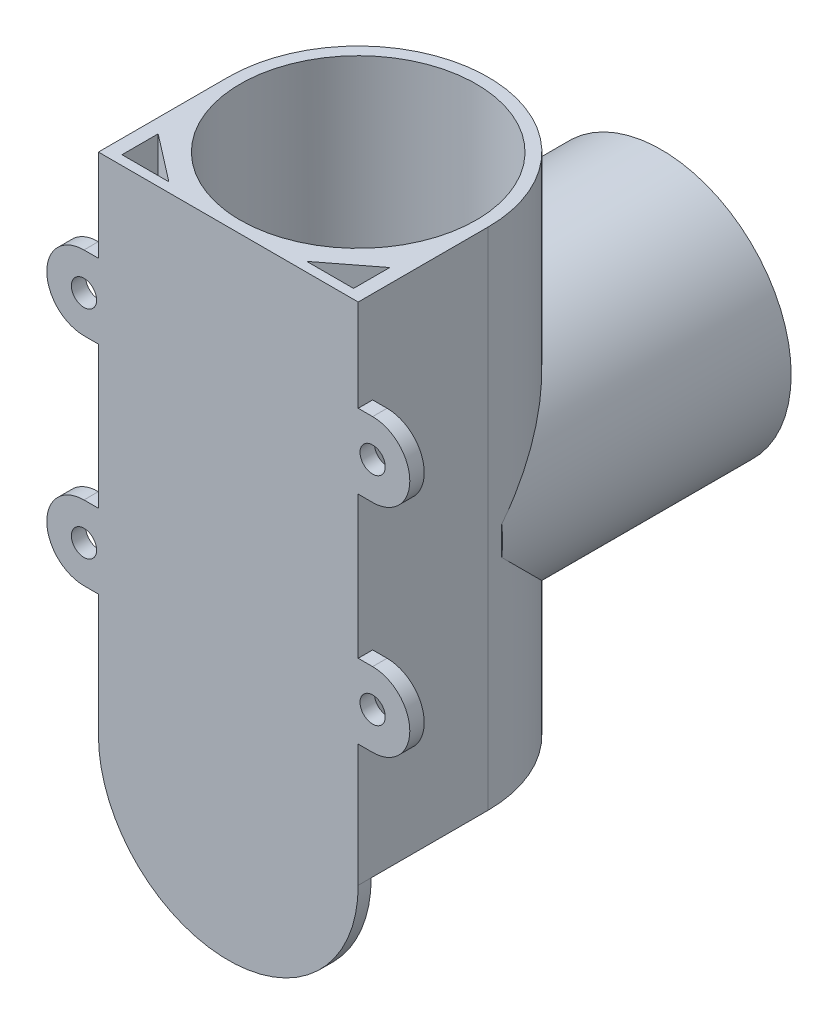
from build123d import *

# Parameters (mm, degrees)
SKETCH1_R               = 16.35
BOSS_EXTRUDE1_DEPTH     = 70
BOSS_EXTRUDE3_DEPTH     = 1.8
SKETCH6_R               = 1.75
BOSS_EXTRUDE4_DEPTH     = 2
CUT_EXTRUDE4_START      = -10
SKETCH2_R               = 15.24
CUT_EXTRUDE4_DEPTH      = 90
EXTRUDE_THIN1_START     = -2
SKETCH8_R               = 18
SKETCH8_R_2             = 16
EXTRUDE_THIN1_DEPTH     = 40
CUT_EXTRUDE5_DEPTH      = 86.419835842
CUT_EXTRUDE5_DEPTH_BACK = 86.419835842
SKETCH9_R               = 16.35


with BuildPart() as part:
    # Sketch1 → Boss-Extrude1 (new body)
    with BuildSketch(Plane(origin=(0, 0, 0), x_dir=(1, 0, 0), z_dir=(0, 1, 0))):
        with BuildLine():
            Line((18, -18), (-18, -18))
            Line((-18, -18), (-18, 0))
            ThreePointArc((-18, 0), (0, 18), (18, 0))
            Line((18, 0), (18, -18))
        make_face()
        Circle(SKETCH1_R, mode=Mode.SUBTRACT)
        Polygon((-16.046179107, -16.69097289), (-9.54916716, -16.69097289), (-16.046179107, -11.676500582), align=None, mode=Mode.SUBTRACT)
        Polygon((16.046179107, -16.69097289), (9.54916716, -16.69097289), (16.046179107, -11.676500582), align=None, mode=Mode.SUBTRACT)
    extrude(amount=BOSS_EXTRUDE1_DEPTH)

    # Sketch4 → Boss-Extrude3 (add)
    with BuildSketch(Plane.XY.offset(18)):
        with BuildLine():
            Line((-18, 0), (18, 0))
            ThreePointArc((18, 0), (0, -18), (-18, 0))
        make_face()
    extrude(amount=-BOSS_EXTRUDE3_DEPTH)

    # Sketch6 → Boss-Extrude4 (add)
    # profile 1 of 4: a face of its own
    with BuildSketch(Plane.XY.offset(18)):
        with BuildLine():
            Line((-12.295931899, 27.247291992), (-12.295931899, 16.947291992))
            Line((-12.295931899, 16.947291992), (-20, 16.947291992))
            ThreePointArc((-20, 16.947291992), (-25.15, 22.097291992), (-20, 27.247291992))
            Line((-20, 27.247291992), (-12.295931899, 27.247291992))
        make_face()
        with Locations((-20, 22.097291992)):
            Circle(SKETCH6_R, mode=Mode.SUBTRACT)
    # profile 2 of 4: a face of its own
    with BuildSketch(Plane.XY.offset(18)):
        with BuildLine():
            Line((-20, 46.94677842), (-12.295931899, 46.94677842))
            Line((-12.295931899, 46.94677842), (-12.295931899, 57.247805565))
            Line((-12.295931899, 57.247805565), (-20, 57.247805565))
            ThreePointArc((-20, 57.247805565), (-25.150513572, 52.097291992), (-20, 46.94677842))
        make_face()
        with Locations((-20, 52.097291992)):
            Circle(SKETCH6_R, mode=Mode.SUBTRACT)
    # profile 3 of 4: a face of its own
    with BuildSketch(Plane.XY.offset(18)):
        with BuildLine():
            Line((9.171216253, 57.247805565), (20, 57.247805565))
            ThreePointArc((20, 57.247805565), (25.150513572, 52.097291992), (20, 46.94677842))
            Line((20, 46.94677842), (9.171216253, 46.94677842))
            Line((9.171216253, 46.94677842), (9.171216253, 57.247805565))
        make_face()
        with Locations((20, 52.097291992)):
            Circle(SKETCH6_R, mode=Mode.SUBTRACT)
    # profile 4 of 4: a face of its own
    with BuildSketch(Plane.XY.offset(18)):
        with BuildLine():
            Line((9.171216253, 27.247291992), (9.171216253, 16.947291992))
            Line((9.171216253, 16.947291992), (20, 16.947291992))
            ThreePointArc((20, 16.947291992), (25.15, 22.097291992), (20, 27.247291992))
            Line((20, 27.247291992), (9.171216253, 27.247291992))
        make_face()
        with Locations((20, 22.097291992)):
            Circle(SKETCH6_R, mode=Mode.SUBTRACT)
    extrude(amount=-BOSS_EXTRUDE4_DEPTH)

    # Sketch2 → Cut-Extrude4 (cut)
    with BuildSketch(Plane.XY.offset(18).offset(CUT_EXTRUDE4_START)):
        with Locations((0, 31.291569462)):
            Circle(SKETCH2_R)
    extrude(amount=-CUT_EXTRUDE4_DEPTH, mode=Mode.SUBTRACT)

    # Sketch8 → Extrude-Thin1 (add)
    with BuildSketch(Plane.XY.offset(EXTRUDE_THIN1_START)):
        with Locations((0, 31.291569462)):
            Circle(SKETCH8_R)
        with Locations((0, 31.291569462)):
            Circle(SKETCH8_R_2, mode=Mode.SUBTRACT)
    extrude(amount=-EXTRUDE_THIN1_DEPTH)

    # Sketch9 → Cut-Extrude5 (cut, two sides: drawn at the far end of the back side and taken through both)
    with BuildSketch(Plane(origin=(0, 0, 0), x_dir=(1, 0, 0), z_dir=(0, 1, 0)).offset(-CUT_EXTRUDE5_DEPTH_BACK)):
        Circle(SKETCH9_R)
    extrude(amount=CUT_EXTRUDE5_DEPTH + CUT_EXTRUDE5_DEPTH_BACK, mode=Mode.SUBTRACT)


solid = part.part
